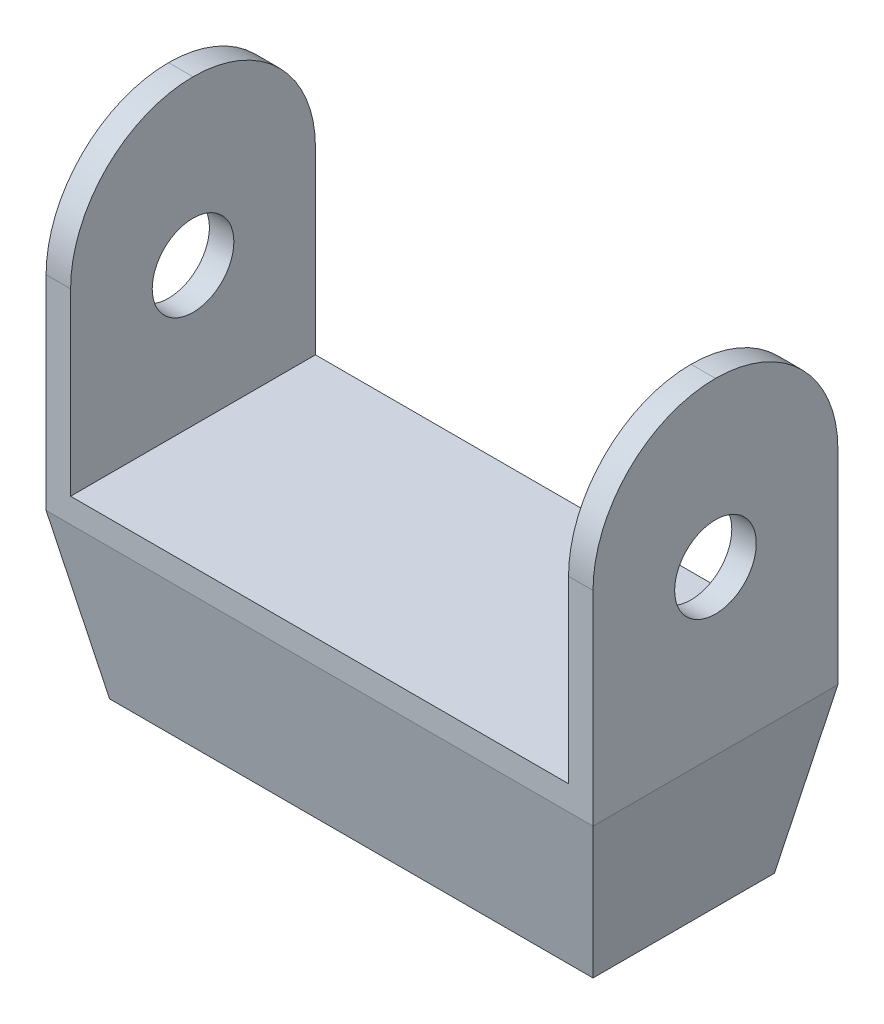
from build123d import *

# Parameters (mm, degrees)
BOSS_EXTRUDE1_DEPTH = 30
SKETCH2_R           = 5
CUT_EXTRUDE1_DEPTH  = 90
FILLET1_R           = 15
SKETCH3_W           = 67
SKETCH3_H           = 30
BOSS_EXTRUDE2_DEPTH = 20
BOSS_EXTRUDE2_TAPER = 11
SKETCH4_R           = 5
CUT_EXTRUDE2_DEPTH  = 5


with BuildPart() as part:
    # Sketch1 → Boss-Extrude1 (new body)
    with BuildSketch(Plane.XY):
        Polygon((0, 0), (30.5, 0), (30.5, 37), (33.5, 37), (33.5, -3), (0, -3), align=None)
    boss_extrude1 = extrude(amount=BOSS_EXTRUDE1_DEPTH)

    # Mirror1: Boss-Extrude1 across plane
    add(boss_extrude1.mirror(Plane(origin=(0, -3, 30), x_dir=(0, 0, 1), z_dir=(1, 0, 0))))

    # Sketch2 → Cut-Extrude1 (cut)
    with BuildSketch(Plane.ZY.offset(33.5)):
        with Locations((15, 17)):
            Circle(SKETCH2_R)
    extrude(amount=-CUT_EXTRUDE1_DEPTH, mode=Mode.SUBTRACT)

    # Fillet1
    fillet1_edges = [part.edges().sort_by_distance(p)[0] for p in [
        (-32, 37, 30),
        (-32, 37, 0),
        (32, 37, 0),
        (32, 37, 30),
    ]]
    fillet(fillet1_edges, radius=FILLET1_R - 0.0001)  # a hair under: the kernel refuses the full size

    # Sketch3 → Boss-Extrude2 (add)
    with BuildSketch(Plane.XZ.offset(3)):
        with Locations((0, 15)):
            Rectangle(SKETCH3_W, SKETCH3_H)
    extrude(amount=BOSS_EXTRUDE2_DEPTH, taper=BOSS_EXTRUDE2_TAPER)

    # Sketch4 → Cut-Extrude2 (cut)
    with BuildSketch(Plane.XZ.offset(23)):
        with Locations((0, 15)):
            Circle(SKETCH4_R)
    extrude(amount=-CUT_EXTRUDE2_DEPTH, mode=Mode.SUBTRACT)


solid = part.part
